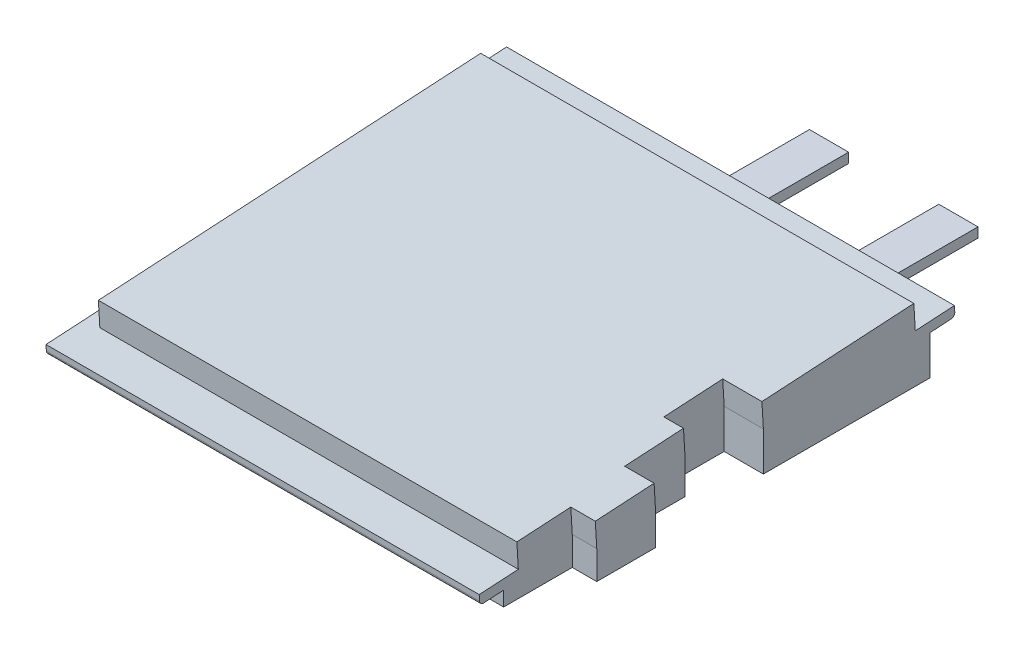
from build123d import *

# Parameters (mm, degrees)
BOSS_EXTRUDE1_DEPTH = 15.875
CUT_EXTRUDE1_DEPTH  = 195.237355702
BOSS_EXTRUDE2_DEPTH = 3.175
FILLET1_R           = 1.27
BOSS_EXTRUDE3_DEPTH = 7.9375
SKETCH5_W           = 12.7
SKETCH5_H           = 3.175
BOSS_EXTRUDE4_DEPTH = 40.9575


with BuildPart() as part:
    # Sketch1 → Boss-Extrude1 (new body)
    with BuildSketch(Plane(origin=(0, 0, 0), x_dir=(1, 0, 0), z_dir=(0, 1, 0))):
        Polygon((0, 0), (137.16, 0), (137.16, -53.975), (124.46, -53.975), (124.46, -73.025), (130.81, -73.025), (130.81, -92.075), (140.335, -92.075), (140.335, -111.125), (132.3975, -111.125), (132.3975, -133.35), (0, -133.35), align=None)
    extrude(amount=BOSS_EXTRUDE1_DEPTH)

    # Sketch2 → Cut-Extrude1 (cut, through all)
    with BuildSketch(Plane.ZY):
        Polygon((133.35, 7.9375), (133.35, 15.875), (0, 15.875), align=None)
    extrude(amount=-CUT_EXTRUDE1_DEPTH, mode=Mode.SUBTRACT)

    # Sketch3 → Boss-Extrude2 (add)
    with BuildSketch(Plane(origin=(0, 15.818952125, 0.941604293), x_dir=(1, 0, 0), z_dir=(0, 0.9982331517348171, 0.05941863998421531))):
        Polygon((-7.9375, 8.88077091), (137.16, 8.88077091), (137.16, -6.99422909), (7.9375, -6.99422909), (7.9375, -124.705255329), (132.3975, -124.705255329), (132.3975, -140.580255329), (-7.9375, -140.580255329), align=None)
    extrude(amount=-BOSS_EXTRUDE2_DEPTH)

    # Fillet1
    fillet1_edges = [part.edges().sort_by_distance(p)[0] for p in [
        (64.61125, 13.177245198, -8.112129824),
        (62.23, 4.296474288, 141.08482146),
        (-7.9375, 8.736859743, 66.486345818),
    ]]
    fillet(fillet1_edges, radius=FILLET1_R)

    # Sketch4 → Boss-Extrude3 (add)
    with BuildSketch(Plane(origin=(0, 15.818952125, 0.941604293), x_dir=(1, 0, 0), z_dir=(0, 0.9982331517348171, 0.05941863998421531))):
        Polygon((-3.175, -3.81922909), (103.849852773, -3.81922909), (137.16, -3.81922909), (137.16, -53.12726352), (124.46, -53.12726352), (124.46, -72.210981554), (130.81, -72.210981554), (130.81, -91.294699588), (140.335, -91.294699588), (140.335, -110.378417623), (132.3975, -110.378417623), (132.3975, -127.880255329), (-3.175, -127.880255329), align=None)
    extrude(amount=BOSS_EXTRUDE3_DEPTH)

    # Sketch5 → Boss-Extrude4 (add)
    with BuildSketch(Plane(origin=(0, 0, 0), x_dir=(-1, 0, 0), z_dir=(0, 0, -1))):
        with Locations((-63.5, 7.615385455)):
            Rectangle(SKETCH5_W, SKETCH5_H)
        with Locations((-105.41, 7.615385455)):
            Rectangle(SKETCH5_W, SKETCH5_H)
    extrude(amount=BOSS_EXTRUDE4_DEPTH)


solid = part.part
